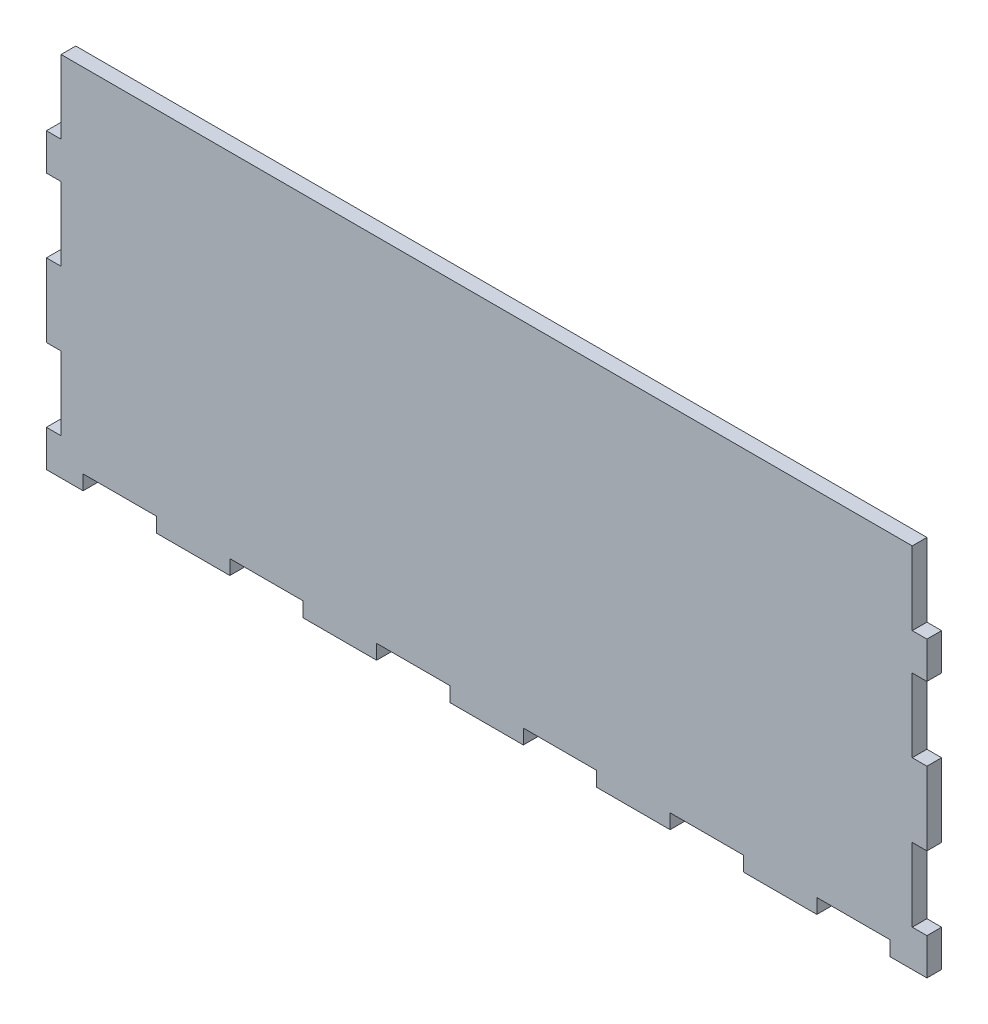
from build123d import *

# Parameters (mm, degrees)
BOSS_EXTRUDE1_DEPTH = 2.54


with BuildPart() as part:
    # Sketch1 → Boss-Extrude1 (new, symmetric)
    with BuildSketch(Plane.XY):
        Polygon((12.7, -127), (-12.7, -127), (-12.7, -121.92), (-38.1, -121.92), (-38.1, -127), (-63.5, -127), (-63.5, -121.92), (-88.9, -121.92), (-88.9, -127), (-114.3, -127), (-114.3, -121.92), (-139.7, -121.92), (-139.7, -127), (-152.4, -127), (-152.4, -114.3), (-147.32, -114.3), (-147.32, -88.9), (-152.4, -88.9), (-152.4, -63.5), (-147.32, -63.5), (-147.32, -38.1), (-152.4, -38.1), (-152.4, -25.4), (-147.32, -25.4), (-147.32, 0), (147.32, 0), (147.32, -25.4), (152.4, -25.4), (152.4, -38.1), (147.32, -38.1), (147.32, -63.5), (152.4, -63.5), (152.4, -88.9), (147.32, -88.9), (147.32, -114.3), (152.4, -114.3), (152.4, -127), (139.7, -127), (139.7, -121.92), (114.3, -121.92), (114.3, -127), (88.9, -127), (88.9, -121.92), (63.5, -121.92), (63.5, -127), (38.1, -127), (38.1, -121.92), (12.7, -121.92), align=None)
    extrude(amount=BOSS_EXTRUDE1_DEPTH, both=True)


solid = part.part
